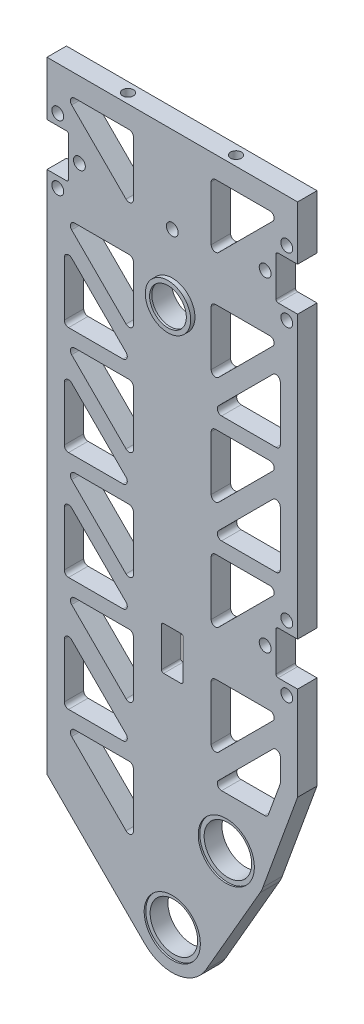
from build123d import *

# Parameters (mm, degrees)
SKETCH_1_R                   = 11
EXTRUDE_569_DEPTH            = 100
EXTRUDE_START                = -100
SKETCH_2_R                   = 11
EXTRUDE_878_DEPTH            = 100
EXTRUDE_2694_DEPTH           = 100
CUT_EXTRUDE_4151_DEPTH       = 534.010318849
CUT_EXTRUDE_4151_DEPTH_BACK  = 534.010318849
SKETCH_3_W                   = 90
SKETCH_3_H                   = 380
SKETCH_5_R                   = 2.5
EXTRUDE_4717_DEPTH           = 100
SKETCH_6_W                   = 191.177045066
SKETCH_6_H                   = 235.084722287
CUT_EXTRUDE_5031_DEPTH       = 84
SKETCH_7_R                   = 75
EXTRUDE_5319_DEPTH           = 5
CUT_EXTRUDE_6101_DEPTH       = 357.195171219
CUT_EXTRUDE_6101_DEPTH_BACK  = 357.195171219
FILLET_2_R                   = 2
MIRROR_START                 = 95
MIRROR_1_DEPTH               = 5
CUT_EXTRUDE_11154_DEPTH      = 357.195171219
CUT_EXTRUDE_11154_DEPTH_BACK = 357.195171219
SKETCH_12_W                  = 10
SKETCH_12_H                  = 20
FILLET_3_R                   = 1
CUT_EXTRUDE_START            = -5
CUT_EXTRUDE_12035_OUTLINE_R  = 5
CUT_EXTRUDE_12035_DEPTH      = 5
CUT_EXTRUDE_7_DEPTH          = 357.195171219
CUT_EXTRUDE_7_DEPTH_BACK     = 357.195171219
SKETCH_14_W                  = 10
SKETCH_14_H                  = 20
FILLET_4_R                   = 1
CUT_EXTRUDE_START_2          = -129
SKETCH_15_R                  = 11
CUT_EXTRUDE_8_DEPTH          = 129
SKETCH_16_R                  = 13
CUT_EXTRUDE_9_DEPTH          = 0.75
CUT_EXTRUDE_START_3          = -0.75
SKETCH_17_R                  = 13
CUT_EXTRUDE_10_DEPTH         = 0.75
SKETCH_18_R                  = 9.5
CUT_EXTRUDE_11_DEPTH         = 113
CUT_EXTRUDE_12_DEPTH         = 357.195171219
CUT_EXTRUDE_12_DEPTH_BACK    = 357.195171219
MOVE_FACE_1_BY               = 4
SKETCH_21_R                  = 2.5
CUT_EXTRUDE_13_DEPTH         = 17
SKETCH_22_R                  = 2.75
CUT_EXTRUDE_14_DEPTH         = 17
CUT_EXTRUDE_15_DEPTH         = 326.338285481
CUT_EXTRUDE_15_DEPTH_BACK    = 326.338285481
SKETCH_23_R                  = 2.75


# Read off the part's stored shape, not the designer's step: 镜向1, 电机安装轴承孔
with BuildPart() as part:
    # 草图1 → Extrude 569 (new body)
    with BuildSketch(Plane.XY):
        with BuildLine():
            Line((-18, 500), (-18, 0))
            ThreePointArc((-18, 0), (0, -18), (18, 0))
            Line((18, 0), (18, 500))
            ThreePointArc((18, 500), (0, 518), (-18, 500))
        make_face()
        with Locations((0, 500)):
            Circle(SKETCH_1_R, mode=Mode.SUBTRACT)
        Circle(SKETCH_1_R, mode=Mode.SUBTRACT)
    extrude(amount=EXTRUDE_569_DEPTH)

    # 草图2 → Extrude 878 (add)
    with BuildSketch(Plane.XY.offset(100).offset(EXTRUDE_START)):
        with BuildLine():
            Line((18, 61.301270189), (25, 61.301270189))
            ThreePointArc((25, 61.301270189), (40.588457268, 52.301270189), (40.588457268, 34.301270189))
            Line((40.588457268, 34.301270189), (15.588457268, -9))
            ThreePointArc((15.588457268, -9), (-4.658742812, -17.386664873), (-18, 0))
            Line((-18, 0), (-18, 61.301270189))
            Line((-18, 61.301270189), (18, 61.301270189))
        make_face()
        with Locations((25, 43.301270189)):
            Circle(SKETCH_2_R, mode=Mode.SUBTRACT)
        Circle(SKETCH_2_R, mode=Mode.SUBTRACT)
    extrude(amount=EXTRUDE_878_DEPTH)

    # 草图10 → Extrude 2694 (add)
    with BuildSketch(Plane(origin=(0, 0, 0), x_dir=(-1, 0, 0), z_dir=(0, 0, -1))):
        with BuildLine():
            Line((-41.914467174, 37.144907609), (-58, 81.339545828))
            Line((-58, 81.339545828), (-58, 320))
            Line((-58, 320), (-18, 320))
            Line((-18, 320), (-18, 61.301270189))
            Line((-18, 61.301270189), (-25, 61.301270189))
            ThreePointArc((-25, 61.301270189), (-39.744736797, 53.625646044), (-41.914467174, 37.144907609))
        make_face()
        with BuildLine():
            Line((12.727922061, -12.727922061), (58, 32.544155877))
            Line((58, 32.544155877), (58, 320))
            Line((58, 320), (18, 320))
            Line((18, 320), (18, 0))
            ThreePointArc((18, 0), (16.629831585, -6.888301783), (12.727922061, -12.727922061))
        make_face()
    extrude(amount=-EXTRUDE_2694_DEPTH)

    # 草图3 → Cut-Extrude 4151 (cut, two sides: drawn at the far end of the back side and taken through both)
    with BuildSketch(Plane.ZY.offset(18).offset(-CUT_EXTRUDE_4151_DEPTH_BACK)):
        with Locations((50, 150)):
            Rectangle(SKETCH_3_W, SKETCH_3_H)
    extrude(amount=CUT_EXTRUDE_4151_DEPTH + CUT_EXTRUDE_4151_DEPTH_BACK, mode=Mode.SUBTRACT)

    # 草图5 → Extrude 4717 (add)
    with BuildSketch(Plane.XY.offset(100)):
        with Locations(Location((0, 250, 0), (0, 0, 90))):
            Circle(SKETCH_5_R)
    extrude(amount=-EXTRUDE_4717_DEPTH)

    # 草图6 → Cut-Extrude 5031 (cut)
    with BuildSketch(Plane(origin=(18, 0, 0), x_dir=(0, 0, -1), z_dir=(1, 0, 0))):
        with Locations((-50.962374235, 437.542361144)):
            Rectangle(SKETCH_6_W, SKETCH_6_H)
    extrude(amount=-CUT_EXTRUDE_5031_DEPTH, mode=Mode.SUBTRACT)

    # 草图7 → Extrude 5319 (add)
    with BuildSketch(Plane(origin=(0, 320, 0), x_dir=(1, 0, 0), z_dir=(0, 1, 0))):
        with Locations(Location((0, -50, 0), (0, 0, 320.654170234))):
            Circle(SKETCH_7_R)
    extrude(amount=EXTRUDE_5319_DEPTH)

    # 草图10<3> → Cut-Extrude 6101 (cut, two sides: drawn at the far end of the back side and taken through both)
    with BuildSketch(Plane(origin=(0, 0, 0), x_dir=(-1, 0, 0), z_dir=(0, 0, -1)).offset(-CUT_EXTRUDE_6101_DEPTH_BACK)):
        Polygon((50, 310), (18, 310), (18, 278), align=None)
        Polygon((-18, 278), (-18, 310), (-50, 310), align=None)
        Polygon((-18, 227.925713543), (-18, 259.925713543), (-50, 259.925713543), align=None)
        Polygon((50, 259.925713543), (18, 259.925713543), (18, 227.925713543), align=None)
        Polygon((50, 248.612005044), (50, 216.612005044), (18, 216.612005044), align=None)
        Polygon((-50, 248.612005044), (-50, 216.612005044), (-18, 216.612005044), align=None)
        Polygon((-18, 177.851427085), (-18, 209.851427085), (-50, 209.851427085), align=None)
        Polygon((50, 209.851427085), (18, 209.851427085), (18, 177.851427085), align=None)
        Polygon((50, 198.537718586), (50, 166.537718586), (18, 166.537718586), align=None)
        Polygon((-50, 198.537718586), (-50, 166.537718586), (-18, 166.537718586), align=None)
        Polygon((-50, 159.777140628), (-18, 127.777140628), (-18, 159.777140628), align=None)
        Polygon((18, 159.777140628), (18, 127.777140628), (50, 159.777140628), align=None)
        Polygon((-50, 109.702854171), (-18, 77.702854171), (-18, 109.702854171), align=None)
        Polygon((18, 109.702854171), (18, 77.702854171), (50, 109.702854171), align=None)
        Polygon((-50, 98.389145672), (-50, 82.750161674), (-44.045077173, 66.389145672), (-18, 66.389145672), align=None)
        Polygon((18, 56.800140588), (18, 24.800140588), (50, 56.800140588), align=None)
        Polygon((50, 95.560718547), (50, 63.560718547), (18, 63.560718547), align=None)
        Polygon((50, 116.463432129), (18, 116.463432129), (50, 148.463432129), align=None)
    extrude(amount=CUT_EXTRUDE_6101_DEPTH + CUT_EXTRUDE_6101_DEPTH_BACK, mode=Mode.SUBTRACT)

    # 圆角2
    fillet_2_edges = [part.edges().sort_by_distance(p)[0] for p in [
        (50, 109.702854171, 2.5),
        (18, 109.702854171, 2.5),
        (18, 77.702854171, 2.5),
        (-18, 159.777140628, 2.5),
        (-50, 159.777140628, 2.5),
        (-18, 127.777140628, 2.5),
        (50, 159.777140628, 2.5),
        (18, 159.777140628, 2.5),
        (18, 127.777140628, 2.5),
        (50, 166.537718586, 2.5),
        (50, 198.537718586, 2.5),
        (18, 166.537718586, 2.5),
        (-50, 63.560718547, 2.5),
        (-18, 63.560718547, 2.5),
        (-50, 95.560718547, 2.5),
        (-50, 56.800140588, 2.5),
        (-18, 24.800140588, 2.5),
        (-18, 56.800140588, 2.5),
        (50, 82.750161674, 2.5),
        (50, 98.389145672, 2.5),
        (18, 66.389145672, 2.5),
        (44.045077173, 66.389145672, 2.5),
        (-18, 109.702854171, 2.5),
        (-50, 109.702854171, 2.5),
        (-18, 77.702854171, 2.5),
        (50, 310, 2.5),
        (18, 310, 2.5),
        (18, 278, 2.5),
        (50, 259.925713543, 2.5),
        (18, 259.925713543, 2.5),
        (18, 227.925713543, 2.5),
        (-50, 248.612005044, 2.5),
        (-50, 216.612005044, 2.5),
        (-18, 216.612005044, 2.5),
        (-18, 259.925713543, 2.5),
        (-50, 259.925713543, 2.5),
        (-18, 227.925713543, 2.5),
        (50, 216.612005044, 2.5),
        (50, 248.612005044, 2.5),
        (18, 216.612005044, 2.5),
        (50, 209.851427085, 2.5),
        (18, 209.851427085, 2.5),
        (18, 177.851427085, 2.5),
        (-50, 198.537718586, 2.5),
        (-50, 166.537718586, 2.5),
        (-18, 166.537718586, 2.5),
        (-18, 209.851427085, 2.5),
        (-50, 209.851427085, 2.5),
        (-18, 177.851427085, 2.5),
        (-50, 148.463432129, 2.5),
        (-50, 116.463432129, 2.5),
        (-18, 116.463432129, 2.5),
        (-18, 310, 2.5),
        (-50, 310, 2.5),
        (-18, 278, 2.5),
    ]]
    fillet(fillet_2_edges, radius=FILLET_2_R)

    # 镜向1 outline → 镜向1 (add)
    with BuildSketch(Plane.XY.offset(MIRROR_START)):
        with BuildLine():
            ThreePointArc((-50, 143.635005004), (-48.765366865, 145.482764069), (-46.585786438, 145.049218567))
            Line((-46.585786438, 145.049218567), (-50, 148.463432129))
            Line((-50, 148.463432129), (-50, 143.635005004))
        make_face()
        with BuildLine():
            Line((-18, 116.463432129), (-21.414213562, 119.877645691))
            ThreePointArc((-21.414213562, 119.877645691), (-20.98066806, 117.698065264), (-22.828427125, 116.463432129))
            Line((-22.828427125, 116.463432129), (-18, 116.463432129))
        make_face()
        with BuildLine():
            ThreePointArc((-48, 116.463432129), (-49.414213562, 117.049218567), (-50, 118.463432129))
            Line((-50, 118.463432129), (-50, 116.463432129))
            Line((-50, 116.463432129), (-48, 116.463432129))
        make_face()
        with BuildLine():
            ThreePointArc((-20, 310), (-18.585786438, 309.414213562), (-18, 308))
            Line((-18, 308), (-18, 310))
            Line((-18, 310), (-20, 310))
        make_face()
        with BuildLine():
            Line((-18, 278), (-18, 282.828427125))
            ThreePointArc((-18, 282.828427125), (-19.234633135, 280.98066806), (-21.414213562, 281.414213562))
            Line((-21.414213562, 281.414213562), (-18, 278))
        make_face()
        with BuildLine():
            ThreePointArc((-46.585786438, 306.585786438), (-47.01933194, 308.765366865), (-45.171572875, 310))
            Line((-45.171572875, 310), (-50, 310))
            Line((-50, 310), (-46.585786438, 306.585786438))
        make_face()
        with BuildLine():
            ThreePointArc((-20, 259.925713543), (-18.585786438, 259.339927105), (-18, 257.925713543))
            Line((-18, 257.925713543), (-18, 259.925713543))
            Line((-18, 259.925713543), (-20, 259.925713543))
        make_face()
        with BuildLine():
            Line((-18, 227.925713543), (-18, 232.754140667))
            ThreePointArc((-18, 232.754140667), (-19.234633135, 230.906381602), (-21.414213562, 231.339927105))
            Line((-21.414213562, 231.339927105), (-18, 227.925713543))
        make_face()
        with BuildLine():
            ThreePointArc((-46.585786438, 256.51149998), (-47.01933194, 258.691080407), (-45.171572875, 259.925713543))
            Line((-45.171572875, 259.925713543), (-50, 259.925713543))
            Line((-50, 259.925713543), (-46.585786438, 256.51149998))
        make_face()
        with BuildLine():
            ThreePointArc((-50, 243.783577919), (-48.765366865, 245.631336984), (-46.585786438, 245.197791481))
            Line((-46.585786438, 245.197791481), (-50, 248.612005044))
            Line((-50, 248.612005044), (-50, 243.783577919))
        make_face()
        with BuildLine():
            Line((-18, 216.612005044), (-21.414213562, 220.026218606))
            ThreePointArc((-21.414213562, 220.026218606), (-20.98066806, 217.846638179), (-22.828427125, 216.612005044))
            Line((-22.828427125, 216.612005044), (-18, 216.612005044))
        make_face()
        with BuildLine():
            ThreePointArc((-48, 216.612005044), (-49.414213563, 217.197791481), (-50, 218.612005044))
            Line((-50, 218.612005044), (-50, 216.612005044))
            Line((-50, 216.612005044), (-48, 216.612005044))
        make_face()
        with BuildLine():
            ThreePointArc((-20, 209.851427085), (-18.585786438, 209.265640647), (-18, 207.851427085))
            Line((-18, 207.851427085), (-18, 209.851427085))
            Line((-18, 209.851427085), (-20, 209.851427085))
        make_face()
        with BuildLine():
            Line((-18, 177.851427085), (-18, 182.67985421))
            ThreePointArc((-18, 182.67985421), (-19.234633135, 180.832095145), (-21.414213562, 181.265640648))
            Line((-21.414213562, 181.265640648), (-18, 177.851427085))
        make_face()
        with BuildLine():
            ThreePointArc((-46.585786438, 206.437213523), (-47.01933194, 208.61679395), (-45.171572875, 209.851427085))
            Line((-45.171572875, 209.851427085), (-50, 209.851427085))
            Line((-50, 209.851427085), (-46.585786438, 206.437213523))
        make_face()
        with BuildLine():
            ThreePointArc((-50, 193.709291462), (-48.765366865, 195.557050527), (-46.585786438, 195.123505024))
            Line((-46.585786438, 195.123505024), (-50, 198.537718586))
            Line((-50, 198.537718586), (-50, 193.709291462))
        make_face()
        with BuildLine():
            Line((-18, 166.537718586), (-21.414213562, 169.951932149))
            ThreePointArc((-21.414213562, 169.951932149), (-20.98066806, 167.772351722), (-22.828427125, 166.537718586))
            Line((-22.828427125, 166.537718586), (-18, 166.537718586))
        make_face()
        with BuildLine():
            ThreePointArc((-48, 166.537718586), (-49.414213562, 167.123505024), (-50, 168.537718586))
            Line((-50, 168.537718586), (-50, 166.537718586))
            Line((-50, 166.537718586), (-48, 166.537718586))
        make_face()
        with BuildLine():
            ThreePointArc((-20, 159.777140628), (-18.585786438, 159.19135419), (-18, 157.777140628))
            Line((-18, 157.777140628), (-18, 159.777140628))
            Line((-18, 159.777140628), (-20, 159.777140628))
        make_face()
        with BuildLine():
            Line((-18, 127.777140628), (-18, 132.605567753))
            ThreePointArc((-18, 132.605567753), (-19.234633135, 130.757808688), (-21.414213562, 131.19135419))
            Line((-21.414213562, 131.19135419), (-18, 127.777140628))
        make_face()
        with BuildLine():
            ThreePointArc((-46.585786438, 156.362927066), (-47.01933194, 158.542507493), (-45.171572875, 159.777140628))
            Line((-45.171572875, 159.777140628), (-50, 159.777140628))
            Line((-50, 159.777140628), (-46.585786438, 156.362927066))
        make_face()
        with BuildLine():
            ThreePointArc((-20, 109.702854171), (-18.585786438, 109.117067733), (-18, 107.702854171))
            Line((-18, 107.702854171), (-18, 109.702854171))
            Line((-18, 109.702854171), (-20, 109.702854171))
        make_face()
        with BuildLine():
            Line((-18, 77.702854171), (-18, 82.531281295))
            ThreePointArc((-18, 82.531281295), (-19.234633135, 80.68352223), (-21.414213562, 81.117067733))
            Line((-21.414213562, 81.117067733), (-18, 77.702854171))
        make_face()
        with BuildLine():
            ThreePointArc((-46.585786438, 106.288640608), (-47.01933194, 108.468221035), (-45.171572875, 109.702854171))
            Line((-45.171572875, 109.702854171), (-50, 109.702854171))
            Line((-50, 109.702854171), (-46.585786438, 106.288640608))
        make_face()
        with BuildLine():
            ThreePointArc((-50, 90.732291422), (-48.765366865, 92.580050487), (-46.585786438, 92.146504984))
            Line((-46.585786438, 92.146504984), (-50, 95.560718547))
            Line((-50, 95.560718547), (-50, 90.732291422))
        make_face()
        with BuildLine():
            Line((-18, 63.560718547), (-21.414213562, 66.974932109))
            ThreePointArc((-21.414213562, 66.974932109), (-20.98066806, 64.795351682), (-22.828427125, 63.560718547))
            Line((-22.828427125, 63.560718547), (-18, 63.560718547))
        make_face()
        with BuildLine():
            ThreePointArc((-48, 63.560718547), (-49.414213562, 64.146504984), (-50, 65.560718547))
            Line((-50, 65.560718547), (-50, 63.560718547))
            Line((-50, 63.560718547), (-48, 63.560718547))
        make_face()
        with BuildLine():
            ThreePointArc((-46.585786438, 53.385927026), (-47.01933194, 55.565507453), (-45.171572875, 56.800140588))
            Line((-45.171572875, 56.800140588), (-50, 56.800140588))
            Line((-50, 56.800140588), (-46.585786438, 53.385927026))
        make_face()
        with BuildLine():
            Line((-18, 56.800140588), (-20, 56.800140588))
            ThreePointArc((-20, 56.800140588), (-18.585786437, 56.214354151), (-18, 54.800140588))
            Line((-18, 54.800140588), (-18, 56.800140588))
        make_face()
        with BuildLine():
            ThreePointArc((-18, 29.628567713), (-19.234633135, 27.780808648), (-21.414213562, 28.214354151))
            Line((-21.414213562, 28.214354151), (-18, 24.800140588))
            Line((-18, 24.800140588), (-18, 29.628567713))
        make_face()
        with BuildLine():
            ThreePointArc((46.585786438, 94.974932109), (48.765366865, 95.408477612), (50, 93.560718547))
            Line((50, 93.560718547), (50, 98.389145672))
            Line((50, 98.389145672), (46.585786438, 94.974932109))
        make_face()
        with BuildLine():
            Line((50, 82.750161674), (50, 83.102815635))
            ThreePointArc((50, 83.102815635), (49.969615506, 82.75551928), (49.879385242, 82.418775349))
            Line((49.879385242, 82.418775349), (50, 82.750161674))
        make_face()
        with BuildLine():
            ThreePointArc((22.828427125, 66.389145672), (20.98066806, 67.623778807), (21.414213562, 69.803359234))
            Line((21.414213562, 69.803359234), (18, 66.389145672))
            Line((18, 66.389145672), (22.828427125, 66.389145672))
        make_face()
        with BuildLine():
            Line((44.045077173, 66.389145672), (44.524047338, 67.705105385))
            ThreePointArc((44.524047338, 67.705105385), (43.791814969, 66.750841583), (42.644662096, 66.389145672))
            Line((42.644662096, 66.389145672), (44.045077173, 66.389145672))
        make_face()
        with BuildLine():
            Line((18, 109.702854171), (18, 107.702854171))
            ThreePointArc((18, 107.702854171), (18.585786438, 109.117067733), (20, 109.702854171))
            Line((20, 109.702854171), (18, 109.702854171))
        make_face()
        with BuildLine():
            ThreePointArc((21.414213562, 81.117067733), (19.234633135, 80.68352223), (18, 82.531281295))
            Line((18, 82.531281295), (18, 77.702854171))
            Line((18, 77.702854171), (21.414213562, 81.117067733))
        make_face()
        with BuildLine():
            Line((50, 109.702854171), (45.171572875, 109.702854171))
            ThreePointArc((45.171572875, 109.702854171), (47.01933194, 108.468221035), (46.585786438, 106.288640608))
            Line((46.585786438, 106.288640608), (50, 109.702854171))
        make_face()
        with BuildLine():
            Line((18, 159.777140628), (18, 157.777140628))
            ThreePointArc((18, 157.777140628), (18.585786438, 159.19135419), (20, 159.777140628))
            Line((20, 159.777140628), (18, 159.777140628))
        make_face()
        with BuildLine():
            ThreePointArc((21.414213562, 131.19135419), (19.234633135, 130.757808688), (18, 132.605567753))
            Line((18, 132.605567753), (18, 127.777140628))
            Line((18, 127.777140628), (21.414213562, 131.19135419))
        make_face()
        with BuildLine():
            Line((50, 159.777140628), (45.171572875, 159.777140628))
            ThreePointArc((45.171572875, 159.777140628), (47.01933194, 158.542507493), (46.585786438, 156.362927066))
            Line((46.585786438, 156.362927066), (50, 159.777140628))
        make_face()
        with BuildLine():
            ThreePointArc((50, 168.537718586), (49.414213562, 167.123505024), (48, 166.537718586))
            Line((48, 166.537718586), (50, 166.537718586))
            Line((50, 166.537718586), (50, 168.537718586))
        make_face()
        with BuildLine():
            Line((18, 166.537718586), (22.828427125, 166.537718586))
            ThreePointArc((22.828427125, 166.537718586), (20.98066806, 167.772351722), (21.414213562, 169.951932149))
            Line((21.414213562, 169.951932149), (18, 166.537718586))
        make_face()
        with BuildLine():
            ThreePointArc((46.585786438, 195.123505024), (48.765366865, 195.557050527), (50, 193.709291462))
            Line((50, 193.709291462), (50, 198.537718586))
            Line((50, 198.537718586), (46.585786438, 195.123505024))
        make_face()
        with BuildLine():
            Line((18, 177.851427085), (21.414213562, 181.265640648))
            ThreePointArc((21.414213562, 181.265640648), (19.234633135, 180.832095145), (18, 182.67985421))
            Line((18, 182.67985421), (18, 177.851427085))
        make_face()
        with BuildLine():
            ThreePointArc((45.171572875, 209.851427085), (47.01933194, 208.61679395), (46.585786438, 206.437213523))
            Line((46.585786438, 206.437213523), (50, 209.851427085))
            Line((50, 209.851427085), (45.171572875, 209.851427085))
        make_face()
        with BuildLine():
            Line((18, 209.851427085), (18, 207.851427085))
            ThreePointArc((18, 207.851427085), (18.585786438, 209.265640647), (20, 209.851427085))
            Line((20, 209.851427085), (18, 209.851427085))
        make_face()
        with BuildLine():
            ThreePointArc((50, 218.612005044), (49.414213563, 217.197791481), (48, 216.612005044))
            Line((48, 216.612005044), (50, 216.612005044))
            Line((50, 216.612005044), (50, 218.612005044))
        make_face()
        with BuildLine():
            Line((18, 216.612005044), (22.828427125, 216.612005044))
            ThreePointArc((22.828427125, 216.612005044), (20.98066806, 217.846638179), (21.414213562, 220.026218606))
            Line((21.414213562, 220.026218606), (18, 216.612005044))
        make_face()
        with BuildLine():
            ThreePointArc((46.585786438, 245.197791481), (48.765366865, 245.631336984), (50, 243.783577919))
            Line((50, 243.783577919), (50, 248.612005044))
            Line((50, 248.612005044), (46.585786438, 245.197791481))
        make_face()
        with BuildLine():
            Line((18, 227.925713543), (21.414213562, 231.339927105))
            ThreePointArc((21.414213562, 231.339927105), (19.234633135, 230.906381602), (18, 232.754140667))
            Line((18, 232.754140667), (18, 227.925713543))
        make_face()
        with BuildLine():
            ThreePointArc((45.171572875, 259.925713543), (47.01933194, 258.691080407), (46.585786438, 256.51149998))
            Line((46.585786438, 256.51149998), (50, 259.925713543))
            Line((50, 259.925713543), (45.171572875, 259.925713543))
        make_face()
        with BuildLine():
            Line((18, 259.925713543), (18, 257.925713543))
            ThreePointArc((18, 257.925713543), (18.585786438, 259.339927105), (20, 259.925713543))
            Line((20, 259.925713543), (18, 259.925713543))
        make_face()
        with BuildLine():
            Line((18, 278), (21.414213562, 281.414213562))
            ThreePointArc((21.414213562, 281.414213562), (19.234633135, 280.98066806), (18, 282.828427125))
            Line((18, 282.828427125), (18, 278))
        make_face()
        with BuildLine():
            ThreePointArc((45.171572875, 310), (47.01933194, 308.765366865), (46.585786438, 306.585786438))
            Line((46.585786438, 306.585786438), (50, 310))
            Line((50, 310), (45.171572875, 310))
        make_face()
        with BuildLine():
            Line((18, 310), (18, 308))
            ThreePointArc((18, 308), (18.585786438, 309.414213562), (20, 310))
            Line((20, 310), (18, 310))
        make_face()
    extrude(amount=MIRROR_1_DEPTH)

    # 草图12 → Cut-Extrude 11154 (cut, two sides: drawn at the far end of the back side and taken through both)
    with BuildSketch(Plane(origin=(0, 0, 0), x_dir=(-1, 0, 0), z_dir=(0, 0, -1)).offset(-CUT_EXTRUDE_11154_DEPTH_BACK)):
        with Locations((-53, 285)):
            Rectangle(SKETCH_12_W, SKETCH_12_H)
        with Locations((-53, 134.702854171)):
            Rectangle(SKETCH_12_W, SKETCH_12_H)
        with Locations((53, 285)):
            Rectangle(SKETCH_12_W, SKETCH_12_H)
    extrude(amount=CUT_EXTRUDE_11154_DEPTH + CUT_EXTRUDE_11154_DEPTH_BACK, mode=Mode.SUBTRACT)

    # 圆角3
    fillet_3_edges = [part.edges().sort_by_distance(p)[0] for p in [
        (-48, 275, 2.5),
        (-48, 295, 2.5),
        (-48, 275, 97.5),
        (-48, 295, 97.5),
        (48, 144.702854171, 2.5),
        (48, 124.702854171, 2.5),
        (48, 144.702854171, 97.5),
        (48, 124.702854171, 97.5),
        (48, 295, 2.5),
        (48, 275, 2.5),
        (48, 295, 97.5),
        (48, 275, 97.5),
    ]]
    fillet(fillet_3_edges, radius=FILLET_3_R)

    # Cut-Extrude 12035 outline → Cut-Extrude 12035 (cut)
    with BuildSketch(Plane.XY.offset(5).offset(CUT_EXTRUDE_START)):
        with Locations((0, 250)):
            Circle(CUT_EXTRUDE_12035_OUTLINE_R)
    cut_extrude_12035 = extrude(amount=CUT_EXTRUDE_12035_DEPTH, mode=Mode.SUBTRACT)

    # 镜向2: Cut-Extrude 12035 across plane
    add(cut_extrude_12035.mirror(Plane(origin=(0, 0, 50), x_dir=(1, 0, 0), z_dir=(0, 0, -1))), mode=Mode.SUBTRACT)

    # 草图14 → 切除-拉伸7 (cut, two sides: drawn at the far end of the back side and taken through both)
    with BuildSketch(Plane(origin=(0, 0, 0), x_dir=(-1, 0, 0), z_dir=(0, 0, -1)).offset(-CUT_EXTRUDE_7_DEPTH_BACK)):
        with Locations((0, 110)):
            Rectangle(SKETCH_14_W, SKETCH_14_H)
    extrude(amount=CUT_EXTRUDE_7_DEPTH + CUT_EXTRUDE_7_DEPTH_BACK, mode=Mode.SUBTRACT)

    # 圆角4
    fillet_4_edges = [part.edges().sort_by_distance(p)[0] for p in [
        (5, 100, 2.5),
        (5, 120, 2.5),
        (-5, 120, 2.5),
        (-5, 100, 2.5),
        (5, 100, 97.5),
        (5, 120, 97.5),
        (-5, 120, 97.5),
        (-5, 100, 97.5),
    ]]
    fillet(fillet_4_edges, radius=FILLET_4_R)

    # 草图15 → 切除-拉伸8 (cut)
    with BuildSketch(Plane.XY.offset(100).offset(CUT_EXTRUDE_START_2)):
        with Locations((25, 43.301270189)):
            Circle(SKETCH_15_R)
    extrude(amount=CUT_EXTRUDE_8_DEPTH, mode=Mode.SUBTRACT)

    # 草图16 → 切除-拉伸9 (cut)
    with BuildSketch(Plane.XY.offset(100)):
        with Locations((25, 43.301270189)):
            Circle(SKETCH_16_R)
        Circle(SKETCH_16_R)
    extrude(amount=-CUT_EXTRUDE_9_DEPTH, mode=Mode.SUBTRACT)

    # 草图17 → 切除-拉伸10 (cut)
    with BuildSketch(Plane(origin=(0, 0, 0), x_dir=(-1, 0, 0), z_dir=(0, 0, -1)).offset(CUT_EXTRUDE_START_3)):
        with Locations(Location((0, 0, 0), (0, 0, 180))):
            Circle(SKETCH_17_R)
        with Locations(Location((-25, 43.301270189, 0), (0, 0, 180))):
            Circle(SKETCH_17_R)
    extrude(amount=CUT_EXTRUDE_10_DEPTH, mode=Mode.SUBTRACT)

    # 草图18 → 切除-拉伸11 (cut)
    with BuildSketch(Plane.XY.offset(100)):
        with Locations((0, 250)):
            Circle(SKETCH_18_R)
    extrude(amount=-CUT_EXTRUDE_11_DEPTH, mode=Mode.SUBTRACT)

    # 草图19 → 旋转1 (revolve)
    with BuildSketch(Plane(origin=(0, 0, 0), x_dir=(0, 0, -1), z_dir=(1, 0, 0)), mode=Mode.PRIVATE) as revolve_1_sk:
        Polygon((0, 239.5), (2, 239.5), (2, 241.5), (1, 241.5), (1, 240.5), (0, 240.5), align=None)
        Polygon((-100, 239.5), (-102, 239.5), (-102, 241.5), (-101, 241.5), (-101, 240.5), (-100, 240.5), align=None)
    revolve(revolve_1_sk.sketch.rotate(Axis((0, 250, 0), (0, 0, 1)), 270), axis=Axis((0, 250, 0), (0, 0, 1)))

    # 草图20 → 切除-拉伸12 (cut, two sides: drawn at the far end of the back side and taken through both)
    with BuildSketch(Plane(origin=(0, 0, 0), x_dir=(0, 0, -1), z_dir=(1, 0, 0)).offset(-CUT_EXTRUDE_12_DEPTH_BACK)):
        Polygon((25, 325), (-125, 325), (-125, 320), (-25.33563281, 320), (-25.33563281, -69.714061667), (25, -69.714061667), align=None)
    extrude(amount=CUT_EXTRUDE_12_DEPTH + CUT_EXTRUDE_12_DEPTH_BACK, mode=Mode.SUBTRACT)

    # Move Face 1: a face moved outward by 4.0
    extrude(part.faces().sort_by_distance((-0.85211942, 163.36467429, 95))[0], amount=MOVE_FACE_1_BY, dir=(0, 0, -1))

    # 草图21 → 切除-拉伸13 (cut)
    with BuildSketch(Plane(origin=(0, 320, 0), x_dir=(1, 0, 0), z_dir=(0, 1, 0))):
        with Locations(Location((-25, -95.5, 0), (0, 0, 270))):
            Circle(SKETCH_21_R)
        with Locations(Location((25, -95.5, 0), (0, 0, 270))):
            Circle(SKETCH_21_R)
    extrude(amount=-CUT_EXTRUDE_13_DEPTH, mode=Mode.SUBTRACT)

    # 草图22 → 切除-拉伸14 (cut)
    with BuildSketch(Plane.XY.offset(100)):
        with Locations((0, 280)):
            Circle(SKETCH_22_R)
    extrude(amount=-CUT_EXTRUDE_14_DEPTH, mode=Mode.SUBTRACT)

    # 草图23 → 切除-拉伸15 (cut, two sides: drawn at the far end of the back side and taken through both)
    with BuildSketch(Plane.XY.offset(100).offset(-CUT_EXTRUDE_15_DEPTH_BACK)):
        with Locations((53, 300)):
            Circle(SKETCH_23_R)
        with Locations((43, 285)):
            Circle(SKETCH_23_R)
        with Locations((53, 270)):
            Circle(SKETCH_23_R)
        with Locations((-53, 300)):
            Circle(SKETCH_23_R)
        with Locations((-43, 285)):
            Circle(SKETCH_23_R)
        with Locations((-53, 270)):
            Circle(SKETCH_23_R)
        with Locations((53, 149.702854171)):
            Circle(SKETCH_23_R)
        with Locations((43, 134.702854171)):
            Circle(SKETCH_23_R)
        with Locations((53, 119.702854171)):
            Circle(SKETCH_23_R)
    extrude(amount=CUT_EXTRUDE_15_DEPTH + CUT_EXTRUDE_15_DEPTH_BACK, mode=Mode.SUBTRACT)


solid = part.part
